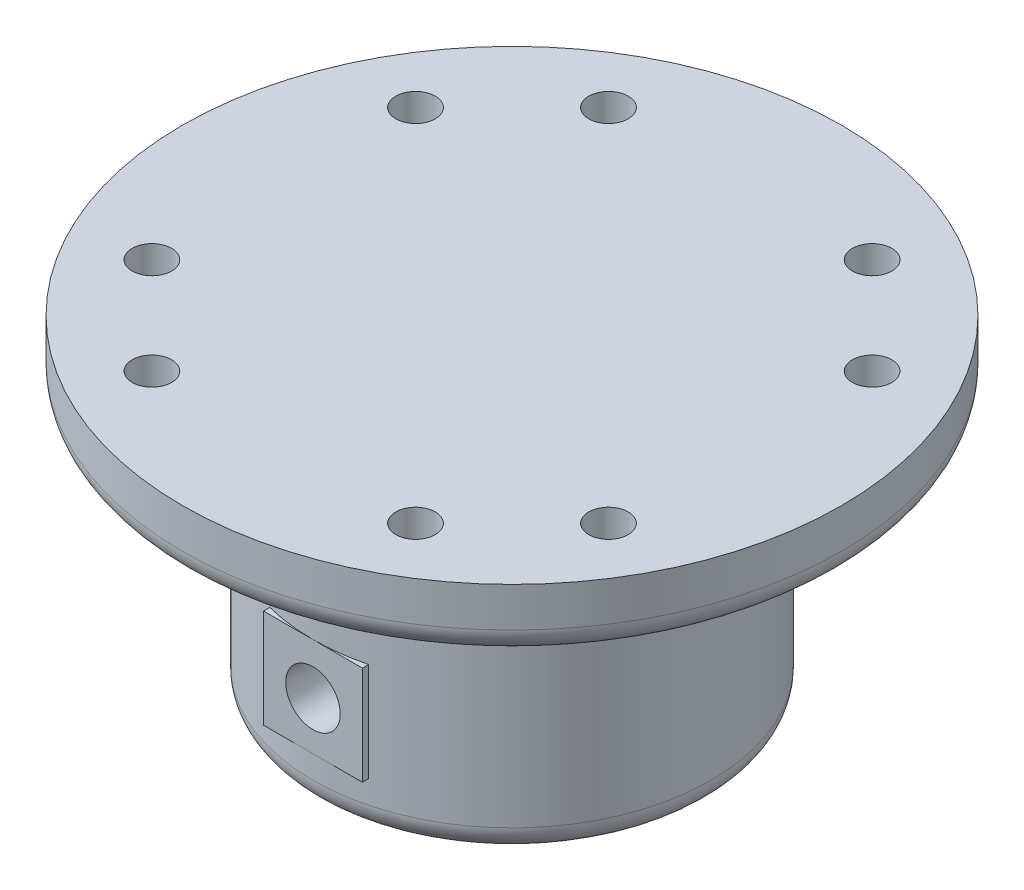
from build123d import *

# Parameters (mm, degrees)
SKETCH2_R               = 31.75
BOSS_EXTRUDE1_DEPTH     = 6.35
SKETCH3_R               = 19.177
BOSS_EXTRUDE2_DEPTH     = 25.4
SKETCH9_W               = 3.175
SKETCH9_H               = 9.525
BOSS_EXTRUDE4_DEPTH     = 4.7625
SKETCH4_R               = 12.827
CUT_EXTRUDE1_DEPTH      = 52.587643869
SKETCH5_R               = 1.90000001
CUT_EXTRUDE2_DEPTH      = 52.587643869
CUT_EXTRUDE3_DEPTH      = 52.587643869
CUT_EXTRUDE3_DEPTH_BACK = 52.587643869
SKETCH7_R               = 2.626999953
CIRPATTERN2_COUNT       = 4
FILLET1_R               = 2.54


with BuildPart() as part:
    # Sketch2 → Boss-Extrude1 (new body)
    with BuildSketch(Plane(origin=(0, 0, 0), x_dir=(1, 0, 0), z_dir=(0, 1, 0))):
        Circle(SKETCH2_R)
    extrude(amount=BOSS_EXTRUDE1_DEPTH)

    # Sketch3 → Boss-Extrude2 (add)
    with BuildSketch(Plane(origin=(0, 0, 0), x_dir=(1, 0, 0), z_dir=(0, 1, 0))):
        Circle(SKETCH3_R)
    extrude(amount=-BOSS_EXTRUDE2_DEPTH)

    # Sketch9 → Boss-Extrude4 (add, symmetric)
    with BuildSketch(Plane(origin=(0, 0, 0), x_dir=(0, 0, -1), z_dir=(1, 0, 0))):
        with Locations((-17.5895, -15.875)):
            Rectangle(SKETCH9_W, SKETCH9_H)
        with Locations((17.5895, -15.875)):
            Rectangle(SKETCH9_W, SKETCH9_H)
    extrude(amount=BOSS_EXTRUDE4_DEPTH, both=True)

    # Sketch4 → Cut-Extrude1 (cut, through all)
    with BuildSketch(Plane(origin=(0, 0, 0), x_dir=(1, 0, 0), z_dir=(0, 1, 0))):
        Circle(SKETCH4_R)
    extrude(amount=-CUT_EXTRUDE1_DEPTH, mode=Mode.SUBTRACT)

    # Sketch5 → Cut-Extrude2 (cut, through all)
    with BuildSketch(Plane(origin=(0, 0, 0), x_dir=(1, 0, 0), z_dir=(0, 1, 0))):
        with Locations((21.997045256, 12.7)):
            Circle(SKETCH5_R)
        with Locations((21.997045256, -12.7)):
            Circle(SKETCH5_R)
    cut_extrude2 = extrude(amount=CUT_EXTRUDE2_DEPTH, mode=Mode.SUBTRACT)

    # Sketch7 → Cut-Extrude3 (cut, two sides: drawn at the far end of the back side and taken through both)
    with BuildSketch(Plane.XY.offset(-CUT_EXTRUDE3_DEPTH_BACK)):
        with Locations((0, -16.002)):
            Circle(SKETCH7_R)
    extrude(amount=CUT_EXTRUDE3_DEPTH + CUT_EXTRUDE3_DEPTH_BACK, mode=Mode.SUBTRACT)

    # CirPattern2: Cut-Extrude2 ×4 about axis
    cirpattern2_axis = Axis((0, -18.783228813, 0), (0, 1, 0))
    for i in range(1, CIRPATTERN2_COUNT):
        add(cut_extrude2.rotate(cirpattern2_axis, i * 360 / CIRPATTERN2_COUNT), mode=Mode.SUBTRACT)

    # Fillet1
    fillet1_edges = [part.edges().sort_by_distance(p)[0] for p in [
        (-19.177, 0, 0),
        (-12.827, 0, 0),
        (-31.75, 0, 0),
        (-12.827, -25.4, 0),
        (-19.177, -25.4, 0),
    ]]
    fillet(fillet1_edges, radius=FILLET1_R)


solid = part.part
